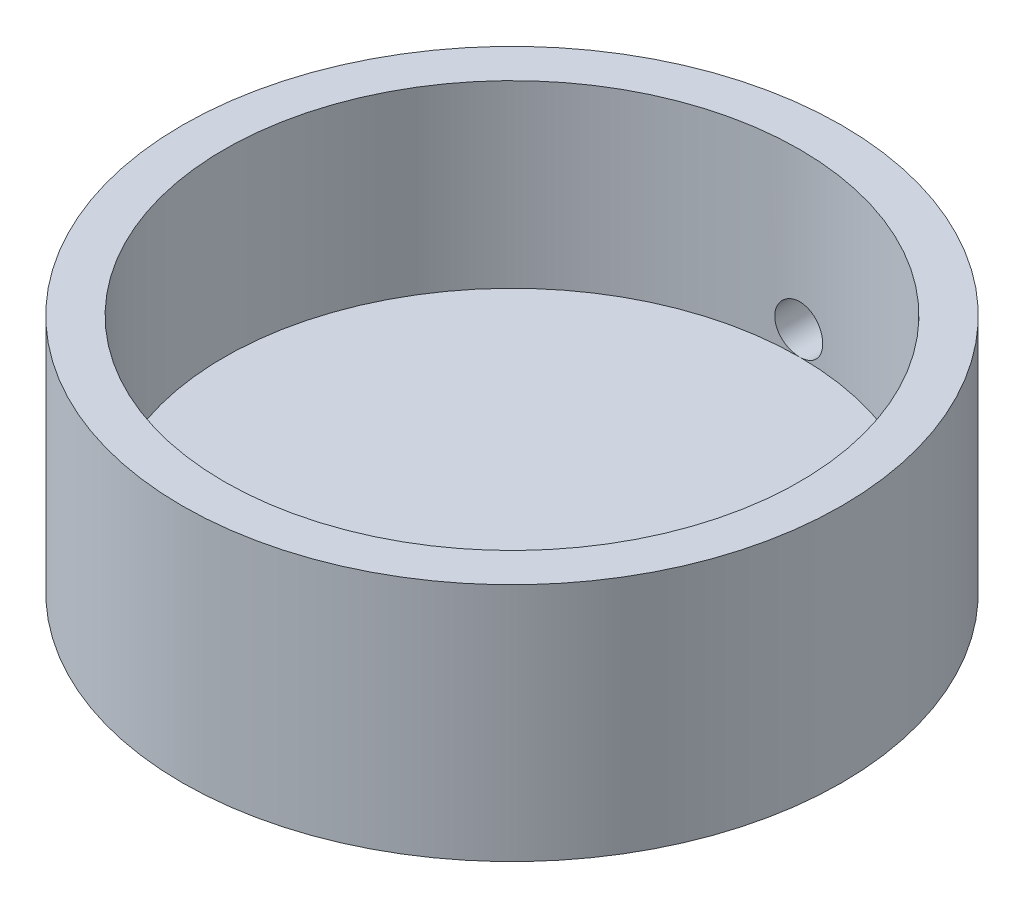
from build123d import *

# Parameters (mm, degrees)
SKETCH1_R           = 27.5
BOSS_EXTRUDE1_DEPTH = 5
SKETCH2_R           = 27.5
SKETCH2_R_2         = 24
BOSS_EXTRUDE2_DEPTH = 15
SKETCH3_R           = 2
CUT_EXTRUDE1_DEPTH  = 74


with BuildPart() as part:
    # Sketch1 → Boss-Extrude1 (new body)
    with BuildSketch(Plane(origin=(0, 0, 0), x_dir=(1, 0, 0), z_dir=(0, 1, 0))):
        Circle(SKETCH1_R)
    extrude(amount=BOSS_EXTRUDE1_DEPTH)

    # Sketch2 → Boss-Extrude2 (add)
    with BuildSketch(Plane(origin=(0, 5, 0), x_dir=(1, 0, 0), z_dir=(0, 1, 0))):
        Circle(SKETCH2_R)
        Circle(SKETCH2_R_2, mode=Mode.SUBTRACT)
    extrude(amount=BOSS_EXTRUDE2_DEPTH)

    # Sketch3 → Cut-Extrude1 (cut)
    with BuildSketch(Plane.XY):
        with Locations((0, 7)):
            Circle(SKETCH3_R)
    extrude(amount=-CUT_EXTRUDE1_DEPTH, mode=Mode.SUBTRACT)


solid = part.part
